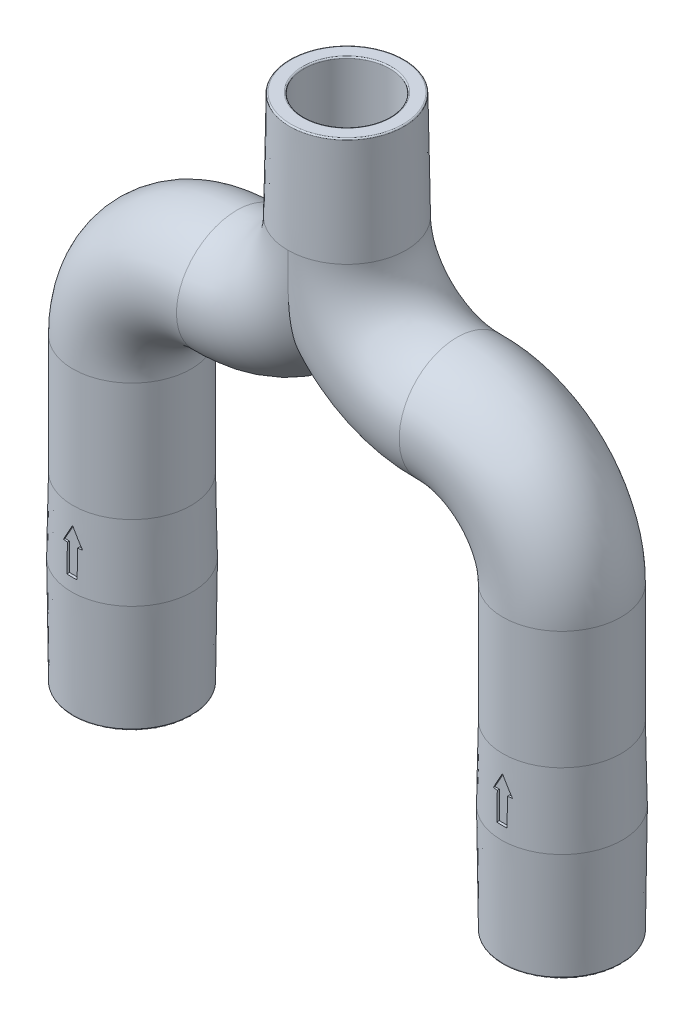
from build123d import *

# Parameters (mm, degrees)
BOSS_EXTRUDE4_DEPTH  = 12.859999996
FILLET1_R            = 1
FILLET2_R            = 0.25
FILLET3_R            = 3
SWEEP1_PROFILE_R     = 11
CUT_SWEEP1_PROFILE_R = 8
FILLET5_R            = 0.25
CUT_EXTRUDE9_DEPTH   = 0.6


# Read off the part's stored shape, not the designer's step: Draft1
with BuildPart() as part:
    # Sketch1 → Revolve1 (revolve)
    with BuildSketch(Plane(origin=(0, 0, 0), x_dir=(0, 0, -1), z_dir=(1, 0, 0)), mode=Mode.PRIVATE) as revolve1_sk:
        Polygon((7.725, 54), (7.55, 38.771909976), (10, 32.871909976), (10, 29.611909976), (8, 29.611909976), (8, 16.751909976), (7.41, 15.73), (7.725, 0), (11, 0), (11.25, 20.2), (11, 34), (11, 54), align=None)
    revolve(revolve1_sk.sketch.rotate(Axis((0, 25.776699029, 0), (0, -1, 0)), 180), axis=Axis((0, 25.776699029, 0), (0, -1, 0)))

    # Sketch2 → Boss-Extrude4 (add)
    with BuildSketch(Plane(origin=(0, 16.75190998, 0), x_dir=(1, 0, 0), z_dir=(0, 1, 0))):
        with BuildLine():
            Line((4.062019202, -0.75), (7.395099729, -0.75))
            ThreePointArc((7.395099729, -0.75), (7.776981037, -0.927251388), (7.888106377, -1.333333333))
            ThreePointArc((7.888106377, -1.333333333), (8, 0), (7.888106377, 1.333333333))
            ThreePointArc((7.888106377, 1.333333333), (7.776981037, 0.927251388), (7.395099729, 0.75))
            Line((7.395099729, 0.75), (4.062019202, 0.75))
            ThreePointArc((4.062019202, 0.75), (3.764974939, 0.847800167), (3.58413459, 1.102941176))
            ThreePointArc((3.58413459, 1.102941176), (3.247595264, 1.875), (2.747242373, 2.552481018))
            ThreePointArc((2.747242373, 2.552481018), (2.616703951, 2.836663859), (2.680528654, 3.14281182))
            Line((2.680528654, 3.14281182), (4.347068917, 6.029344229))
            ThreePointArc((4.347068917, 6.029344229), (4.691513776, 6.271437449), (5.098753727, 6.164633844))
            ThreePointArc((5.098753727, 6.164633844), (4, 6.92820323), (2.78935265, 7.497967177))
            ThreePointArc((2.78935265, 7.497967177), (3.085467261, 7.198688837), (3.048030812, 6.779344229))
            Line((3.048030812, 6.779344229), (1.381490548, 3.89281182))
            ThreePointArc((1.381490548, 3.89281182), (1.148270988, 3.684464026), (0.836892217, 3.655422194))
            ThreePointArc((0.836892217, 3.655422194), (0, 3.75), (-0.836892217, 3.655422194))
            ThreePointArc((-0.836892217, 3.655422194), (-1.148270988, 3.684464026), (-1.381490548, 3.89281182))
            Line((-1.381490548, 3.89281182), (-3.048030812, 6.779344229))
            ThreePointArc((-3.048030812, 6.779344229), (-3.085467261, 7.198688837), (-2.78935265, 7.497967177))
            ThreePointArc((-2.78935265, 7.497967177), (-4, 6.92820323), (-5.098753727, 6.164633844))
            ThreePointArc((-5.098753727, 6.164633844), (-4.691513776, 6.271437449), (-4.347068917, 6.029344229))
            Line((-4.347068917, 6.029344229), (-2.680528654, 3.14281182))
            ThreePointArc((-2.680528654, 3.14281182), (-2.616703951, 2.836663859), (-2.747242373, 2.552481018))
            ThreePointArc((-2.747242373, 2.552481018), (-3.247595264, 1.875), (-3.58413459, 1.102941176))
            ThreePointArc((-3.58413459, 1.102941176), (-3.764974939, 0.847800167), (-4.062019202, 0.75))
            Line((-4.062019202, 0.75), (-7.395099729, 0.75))
            ThreePointArc((-7.395099729, 0.75), (-7.776981037, 0.927251388), (-7.888106377, 1.333333333))
            ThreePointArc((-7.888106377, 1.333333333), (-8, 0), (-7.888106377, -1.333333333))
            ThreePointArc((-7.888106377, -1.333333333), (-7.776981037, -0.927251388), (-7.395099729, -0.75))
            Line((-7.395099729, -0.75), (-4.062019202, -0.75))
            ThreePointArc((-4.062019202, -0.75), (-3.764974939, -0.847800167), (-3.58413459, -1.102941176))
            ThreePointArc((-3.58413459, -1.102941176), (-3.247595264, -1.875), (-2.747242373, -2.552481018))
            ThreePointArc((-2.747242373, -2.552481018), (-2.616703951, -2.836663859), (-2.680528654, -3.14281182))
            Line((-2.680528654, -3.14281182), (-4.347068917, -6.029344229))
            ThreePointArc((-4.347068917, -6.029344229), (-4.691513776, -6.271437449), (-5.098753727, -6.164633844))
            ThreePointArc((-5.098753727, -6.164633844), (-4, -6.92820323), (-2.78935265, -7.497967177))
            ThreePointArc((-2.78935265, -7.497967177), (-3.085467261, -7.198688837), (-3.048030812, -6.779344229))
            Line((-3.048030812, -6.779344229), (-1.381490548, -3.89281182))
            ThreePointArc((-1.381490548, -3.89281182), (-1.148270988, -3.684464026), (-0.836892217, -3.655422194))
            ThreePointArc((-0.836892217, -3.655422194), (0, -3.75), (0.836892217, -3.655422194))
            ThreePointArc((0.836892217, -3.655422194), (1.148270988, -3.684464026), (1.381490548, -3.89281182))
            Line((1.381490548, -3.89281182), (3.048030812, -6.779344229))
            ThreePointArc((3.048030812, -6.779344229), (3.085467261, -7.198688837), (2.78935265, -7.497967177))
            ThreePointArc((2.78935265, -7.497967177), (4, -6.92820323), (5.098753727, -6.164633844))
            ThreePointArc((5.098753727, -6.164633844), (4.691513776, -6.271437449), (4.347068917, -6.029344229))
            Line((4.347068917, -6.029344229), (2.680528654, -3.14281182))
            ThreePointArc((2.680528654, -3.14281182), (2.616703951, -2.836663859), (2.747242373, -2.552481018))
            ThreePointArc((2.747242373, -2.552481018), (3.247595264, -1.875), (3.58413459, -1.102941176))
            ThreePointArc((3.58413459, -1.102941176), (3.764974939, -0.847800167), (4.062019202, -0.75))
        make_face()
    extrude(amount=BOSS_EXTRUDE4_DEPTH)

    # Sketch3 → Cut-Revolve1 (revolve, cut)
    with BuildSketch(Plane.XY, mode=Mode.PRIVATE) as cut_revolve1_sk:
        with BuildLine():
            Line((-2.6, 26.111909976), (-8, 16.75190998))
            Line((-8, 16.75190998), (0, 16.751909976))
            Line((0, 16.751909976), (0, 27.611909976))
            ThreePointArc((0, 27.611909976), (-1.501219512, 27.210690464), (-2.6, 26.111909976))
        make_face()
    revolve(cut_revolve1_sk.sketch.rotate(Axis((0, 0, 0), (0, 1, 0)), 270), axis=Axis((0, 0, 0), (0, 1, 0)), mode=Mode.SUBTRACT)

    # Sketch4 → Revolve2 (revolve)
    with BuildSketch(Plane.XY, mode=Mode.PRIVATE) as revolve2_sk:
        with BuildLine():
            Line((-2.5, 29.611909976), (-2.5, 31.111909976))
            Line((-2.5, 31.111909976), (-3.25, 31.111909976))
            ThreePointArc((-3.25, 31.111909976), (-2.298097039, 33.410007015), (0, 34.361909976))
            Line((0, 34.361909976), (0, 29.611909976))
            Line((0, 29.611909976), (-2.5, 29.611909976))
        make_face()
    revolve(revolve2_sk.sketch.rotate(Axis((0, 0, 0), (0, 1, 0)), 270), axis=Axis((0, 0, 0), (0, 1, 0)))

    # Fillet1
    fillet1_edges = [part.edges().sort_by_distance(p)[0] for p in [
        (0, 15.73, -7.41),
    ]]
    fillet(fillet1_edges, radius=FILLET1_R)

    # Fillet2
    fillet2_edges = [part.edges().sort_by_distance(p)[0] for p in [
        (0, 29.611909976, -10),
        (0, 29.611909976, 2.5),
        (0, 31.111909976, 2.5),
    ]]
    fillet(fillet2_edges, radius=FILLET2_R)

    # Fillet3
    fillet3_edges = [part.edges().sort_by_distance(p)[0] for p in [
        (0, 32.871909976, -10),
        (0, 38.771909976, -7.55),
    ]]
    fillet(fillet3_edges, radius=FILLET3_R)

    # Sweep1: sweep along a path in Sketch8
    with BuildLine(Plane.XY) as sweep1_path:
        Line((-40, 115.143122289), (-40, 95.143122289))
        ThreePointArc((-40, 95.143122289), (-33.902805761, 80.645664916), (-19.276734431, 74.863789329))
        ThreePointArc((-19.276734431, 74.863789329), (-5.671596193, 69.485501827), (0, 56))
        Line((0, 56), (0, 54))
    # Sweep1 profile (on start of the path) → Sweep1 (sweep)
    with BuildSketch(Plane(origin=(-40, 115.143122289, 0), x_dir=(-1, 0, 0), z_dir=(0, -1, 0))):
        Circle(SWEEP1_PROFILE_R)
    sweep(path=sweep1_path.line)

    # Mirror3: part across plane


with BuildPart() as part_1:
    add(part.part)
    add(part.part.mirror(Plane(origin=(-40, 0, 0), x_dir=(0, 0, 1), z_dir=(1, 0, 0))))

    # Cut-Sweep1: sweep along a path in Sketch8<4>
    with BuildLine(Plane.XY) as cut_sweep1_path:
        Line((-40, 115.143122289), (-40, 95.143122289))
        ThreePointArc((-40, 95.143122289), (-33.902805761, 80.645664916), (-19.276734431, 74.863789329))
        ThreePointArc((-19.276734431, 74.863789329), (-5.671596193, 69.485501827), (0, 56))
        Line((0, 56), (0, 54))
    # Cut-Sweep1 profile (on start of the path) → Cut-Sweep1 (sweep, cut)
    with BuildSketch(Plane(origin=(-40, 115.143122289, 0), x_dir=(-1, 0, 0), z_dir=(0, -1, 0))):
        Circle(CUT_SWEEP1_PROFILE_R)
    cut_sweep1 = sweep(path=cut_sweep1_path.line, mode=Mode.SUBTRACT)

    # Mirror4: Cut-Sweep1 across plane
    add(cut_sweep1.mirror(Plane(origin=(-40, 0, 0), x_dir=(0, 0, 1), z_dir=(1, 0, 0))), mode=Mode.SUBTRACT)

    # Draft1 outline → Draft1 (revolve, cut)
    with BuildSketch(Plane(origin=(-40, 0, 0), x_dir=(1, 0, 0), z_dir=(0, 0, 1))):
        Polygon((11, 115.143122289), (10.650898701, 115.143122289), (11, 95.143122289), align=None)
    revolve(axis=Axis((-40, 0, 0), (0, 1, 0)), mode=Mode.SUBTRACT)

    # Fillet5
    fillet5_edges = [part_1.edges().sort_by_distance(p)[0] for p in [
        (0, 0, -7.725),
        (-50.650898701, 115.143122289, 0),
        (-80, 0, -7.725),
        (-80, 0, -11),
        (-32, 115.143122289, 0),
        (0, 0, -11),
    ]]
    fillet(fillet5_edges, radius=FILLET5_R)

    # Sketch53 → Cut-Extrude9 (cut)
    with BuildSketch(Plane.XY.offset(11.3)):
        Polygon((0, 30.826484467), (1.778537377, 27.667512667), (0.951205041, 27.667512667), (0.951205041, 22.591698133), (-0.951205041, 22.591698133), (-0.951205041, 27.667512667), (-1.778537377, 27.667512667), align=None)
        Polygon((-80, 30.826484467), (-78.221462623, 27.667512667), (-79.048794959, 27.667512667), (-79.048794959, 22.591698133), (-80.951205041, 22.591698133), (-80.951205041, 27.667512667), (-81.778537377, 27.667512667), align=None)
    extrude(amount=-CUT_EXTRUDE9_DEPTH, mode=Mode.SUBTRACT)


solid = part_1.part
